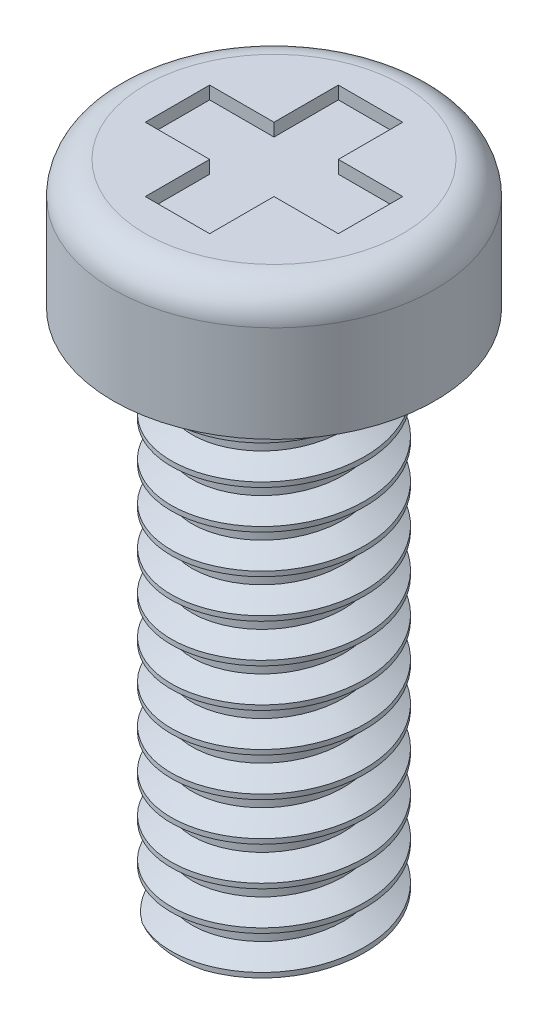
from build123d import *

# Parameters (mm, degrees)
SKETCH1_R           = 2.5
BOSS_EXTRUDE1_DEPTH = 2
SKETCH2_R           = 1.5
BOSS_EXTRUDE2_DEPTH = 8
FILLET1_R           = 0.5
SKETCH4_W           = 1
SKETCH4_H           = 1
SKETCH4_R           = 0.160813075
CUT_EXTRUDE1_DEPTH  = 0.2
THREAD1_PITCH       = 0.6


with BuildPart() as part:
    # Sketch1 → Boss-Extrude1 (new body)
    with BuildSketch(Plane(origin=(0, 0, 0), x_dir=(1, 0, 0), z_dir=(0, 1, 0))):
        with Locations(Location((-8.577384202, -1.271931498, 0), (0, 0, 270))):
            Circle(SKETCH1_R)
    extrude(amount=BOSS_EXTRUDE1_DEPTH)

    # Sketch2 → Boss-Extrude2 (add)
    with BuildSketch(Plane.XZ):
        with Locations(Location((-8.577384202, 1.271931498, 0), (0, 0, 270))):
            Circle(SKETCH2_R)
    extrude(amount=BOSS_EXTRUDE2_DEPTH)

    # Fillet1
    fillet1_edges = [part.edges().sort_by_distance(p)[0] for p in [
        (-8.577384202, 2, -1.228068502),
    ]]
    fillet(fillet1_edges, radius=FILLET1_R)

    # Sketch4 → Cut-Extrude1 (cut)
    # profile 1 of 6: a face of its own
    with BuildSketch(Plane(origin=(0, 2, 0), x_dir=(1, 0, 0), z_dir=(0, 1, 0))):
        with Locations((-8.577384202, -0.271931498)):
            Rectangle(SKETCH4_W, SKETCH4_H)
    # profile 2 of 6: a face of its own
    with BuildSketch(Plane(origin=(0, 2, 0), x_dir=(1, 0, 0), z_dir=(0, 1, 0))):
        with Locations((-8.577384202, -1.271931498)):
            Rectangle(SKETCH4_W, SKETCH4_H)
        with Locations((-8.577384202, -1.271931498)):
            Circle(SKETCH4_R, mode=Mode.SUBTRACT)
    # profile 3 of 6: a face of its own
    with BuildSketch(Plane(origin=(0, 2, 0), x_dir=(1, 0, 0), z_dir=(0, 1, 0))):
        with Locations((-9.577384202, -1.271931498)):
            Rectangle(SKETCH4_W, SKETCH4_H)
    # profile 4 of 6: a face of its own
    with BuildSketch(Plane(origin=(0, 2, 0), x_dir=(1, 0, 0), z_dir=(0, 1, 0))):
        with Locations((-8.577384202, -2.271931498)):
            Rectangle(SKETCH4_W, SKETCH4_H)
    # profile 5 of 6: a face of its own
    with BuildSketch(Plane(origin=(0, 2, 0), x_dir=(1, 0, 0), z_dir=(0, 1, 0))):
        with Locations((-7.577384202, -1.271931498)):
            Rectangle(SKETCH4_W, SKETCH4_H)
    # profile 6 of 6: a face of its own
    with BuildSketch(Plane(origin=(0, 2, 0), x_dir=(1, 0, 0), z_dir=(0, 1, 0))):
        with Locations((-8.577384202, -1.271931498)):
            Circle(SKETCH4_R)
    extrude(amount=-CUT_EXTRUDE1_DEPTH, mode=Mode.SUBTRACT)

    # Thread1: the profile of Thread Profile1 profile screwed along a right-hand helix of 15 turns, 6 arcs to a turn; built about Z, then put on its axis
    thread1_z = Axis((0, 0, 0), (0, 0, 1))
    thread1_corners = [(1.5003, 0, -0.000173205), (1.5003, 0, 0.525173203), (1.175240475, 0, 0.337499999), (1.175240475, 0, 0.187499999)]
    with BuildLine(mode=Mode.PRIVATE) as thread1_profile:
        Line(thread1_corners[0], thread1_corners[1])
        Line(thread1_corners[1], thread1_corners[2])
        Line(thread1_corners[2], thread1_corners[3])
        Line(thread1_corners[3], thread1_corners[0])
    thread1_cap = Face(thread1_profile.wire())
    thread1_turn_angles = [0, 30, 60, 90, 120, 150, 180, 210, 240, 270, 300, 330, 360]
    thread1_turn_weights = [1, 0.8660254037844387, 1, 0.8660254037844387, 1, 0.8660254037844387, 1, 0.8660254037844387, 1, 0.8660254037844387, 1, 0.8660254037844387, 1]
    thread1_turn_rails = [Edge.make_bspline([Vector(p[0], p[1], 0).rotate(thread1_z, thread1_turn_angles[k]) / thread1_turn_weights[k] + Vector(0, 0, p[2] + THREAD1_PITCH * thread1_turn_angles[k] / 360) for k in range(13)], [0, 0, 0, 1, 1, 2, 2, 3, 3, 4, 4, 5, 5, 6, 6, 6], 2, thread1_turn_weights) for p in thread1_corners]
    thread1_turn_sides = [Face.make_surface_from_curves(thread1_turn_rails[p[0]], thread1_turn_rails[p[1]]) for p in [(0, 1), (1, 2), (2, 3), (3, 0)]]
    thread1 = Plane(origin=(-8.577384202, -9, 1.271931498), x_dir=(1, 0, 0), z_dir=(0, 1, 0)) * Solid(Shell([*[p.moved(Location((0, 0, THREAD1_PITCH * i))) for i in range(15) for p in thread1_turn_sides], thread1_cap, thread1_cap.rotate(thread1_z, 5400).moved(Location((0, 0, THREAD1_PITCH * 5400 / 360)))]))
    add(thread1, mode=Mode.SUBTRACT)


solid = part.part
